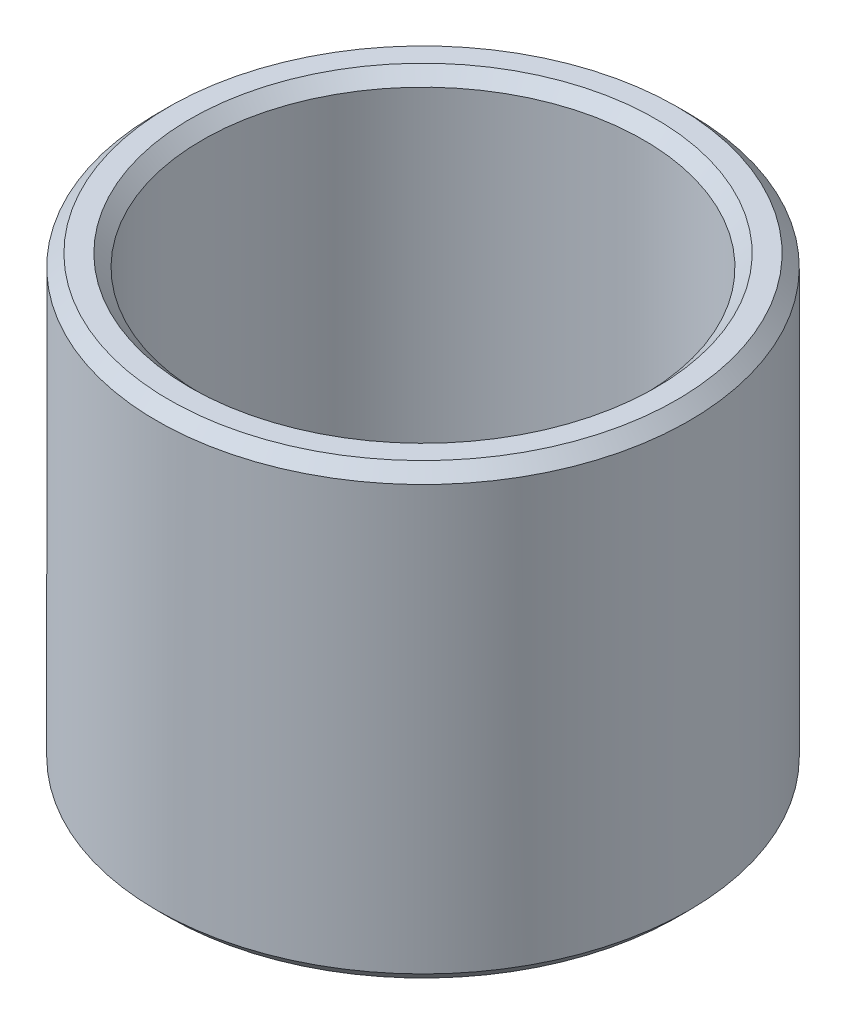
from build123d import *

# Parameters (mm, degrees)
SKETCH1_R           = 47.5
BOSS_EXTRUDE1_DEPTH = 80.002165873
SKETCH2_R           = 39.382518764
CUT_EXTRUDE1_DEPTH  = 105.464570762
CHAMFER1_SIZE       = 2.169257121


with BuildPart() as part:
    # Sketch1 → Boss-Extrude1 (new body)
    with BuildSketch(Plane(origin=(0, 0, 0), x_dir=(1, 0, 0), z_dir=(0, 1, 0))):
        Circle(SKETCH1_R)
    extrude(amount=BOSS_EXTRUDE1_DEPTH)

    # Sketch2 → Cut-Extrude1 (cut, through all)
    with BuildSketch(Plane(origin=(0, 0, 0), x_dir=(1, 0, 0), z_dir=(0, 1, 0))):
        Circle(SKETCH2_R)
    extrude(amount=CUT_EXTRUDE1_DEPTH, mode=Mode.SUBTRACT)

    # Chamfer1
    chamfer1_edges = [part.edges().sort_by_distance(p)[0] for p in [
        (-39.382518764, 80.002165873, 0),
        (-39.382518764, 0, 0),
        (-47.5, 0, 0),
        (-47.5, 80.002165873, 0),
    ]]
    chamfer(chamfer1_edges, length=CHAMFER1_SIZE)


solid = part.part
